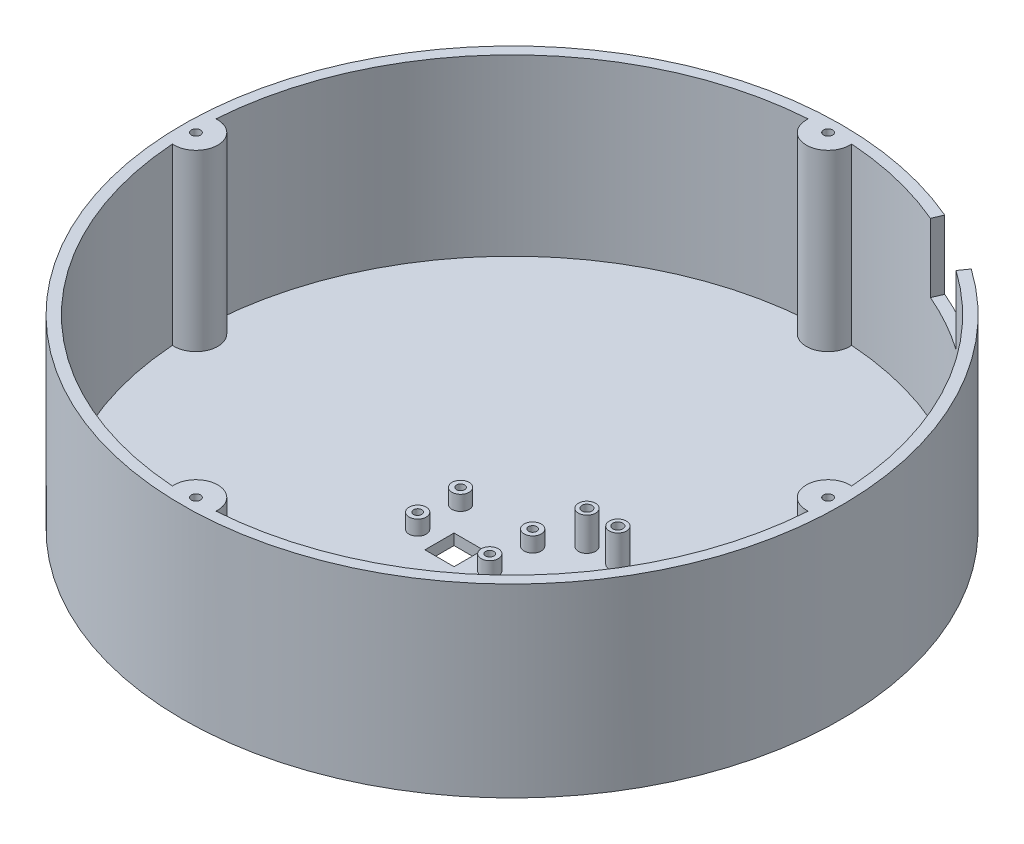
from build123d import *

# Parameters (mm, degrees)
SKETCH1_R                                            = 96
BOSS_EXTRUDE1_DEPTH                                  = 53.975
SKETCH2_R                                            = 1.3208
CUT_EXTRUDE1_DEPTH                                   = 50.8
SKETCH3_R                                            = 6
SKETCH3_W                                            = 8.5
SKETCH3_H                                            = 8.5
CUT_EXTRUDE2_DEPTH                                   = 145.957373045
BOSS_EXTRUDE2_START                                  = 3.175
BOSS_EXTRUDE2_OUTLINE_R                              = 2.5
BOSS_EXTRUDE2_DEPTH                                  = 4.325
BOSS_EXTRUDE3_START                                  = 3.175
BOSS_EXTRUDE3_OUTLINE_R                              = 2.5
BOSS_EXTRUDE3_DEPTH                                  = 9.652
CSK_FOR_M2_5_CROSS_COUNTERSUNK_HEAD_SCRE_D           = 2.9
CSK_FOR_M2_5_CROSS_COUNTERSUNK_HEAD_SCRE_CSINK_D     = 5
CSK_FOR_M2_5_CROSS_COUNTERSUNK_HEAD_SCRE_CSINK_ANGLE = 92
CSK_FOR_M2_CROSS_COUNTERSUNK_HEAD_SCREW1_D           = 2.4
CSK_FOR_M2_CROSS_COUNTERSUNK_HEAD_SCREW1_CSINK_D     = 4
CSK_FOR_M2_CROSS_COUNTERSUNK_HEAD_SCREW1_CSINK_ANGLE = 92
CUT_EXTRUDE4_DEPTH                                   = 20


# Read off the part's stored shape, not the designer's step: Boss-Extrude2, Boss-Extrude3
with BuildPart() as part:
    # Sketch1 → Boss-Extrude1 (new body)
    with BuildSketch(Plane(origin=(0, 0, 0), x_dir=(1, 0, 0), z_dir=(0, 1, 0))):
        with Locations(Location((0, 0, 0), (0, 0, 270))):
            Circle(SKETCH1_R)
    extrude(amount=BOSS_EXTRUDE1_DEPTH)

    # Sketch2 → Cut-Extrude1 (cut)
    with BuildSketch(Plane(origin=(0, 53.975, 0), x_dir=(1, 0, 0), z_dir=(0, 1, 0))):
        with Locations(Location((0, 92.075, 0), (0, 0, 270))):
            Circle(SKETCH2_R)
        with Locations(Location((92.075, 0, 0), (0, 0, 270))):
            Circle(SKETCH2_R)
        with Locations(Location((0, -92.075, 0), (0, 0, 270))):
            Circle(SKETCH2_R)
        with Locations(Location((-92.075, 0, 0), (0, 0, 270))):
            Circle(SKETCH2_R)
        with BuildLine():
            Line((92.609089058, 6.327499417), (92.607548963, 6.35))
            ThreePointArc((92.607548963, 6.35), (65.629212709, 65.64516025), (6.327499417, 92.609089058))
            ThreePointArc((6.327499417, 92.609089058), (0, 85.725), (-6.327499417, 92.609089058))
            ThreePointArc((-6.327499417, 92.609089058), (-65.637186964, 65.637186964), (-92.609089058, 6.327499417))
            ThreePointArc((-92.609089058, 6.327499417), (-85.725, 0), (-92.609089058, -6.327499417))
            Line((-92.609089058, -6.327499417), (-92.607548963, -6.35))
            ThreePointArc((-92.607548963, -6.35), (-65.629212709, -65.64516025), (-6.327499417, -92.609089058))
            ThreePointArc((-6.327499417, -92.609089058), (0, -85.725), (6.327499417, -92.609089058))
            Line((6.327499417, -92.609089058), (6.35, -92.607548963))
            ThreePointArc((6.35, -92.607548963), (65.64516025, -65.629212709), (92.609089058, -6.327499417))
            ThreePointArc((92.609089058, -6.327499417), (85.725, 0), (92.609089058, 6.327499417))
        make_face()
    extrude(amount=-CUT_EXTRUDE1_DEPTH, mode=Mode.SUBTRACT)

    # Sketch3 → Cut-Extrude2 (cut, through all)
    with BuildSketch(Plane(origin=(0, 3.175, 0), x_dir=(1, 0, 0), z_dir=(0, 1, 0))):
        with Locations(Location((23, -16.5546, 0), (0, 0, 270))):
            Circle(SKETCH3_R)
        with Locations((0, -16.8926)):
            Rectangle(SKETCH3_W, SKETCH3_H)
    extrude(amount=-CUT_EXTRUDE2_DEPTH, mode=Mode.SUBTRACT)

    # Boss-Extrude2 outline → Boss-Extrude2 (add)
    with BuildSketch(Plane(origin=(0, 0, 0), x_dir=(1, 0, 0), z_dir=(0, 1, 0)).offset(BOSS_EXTRUDE2_START)):
        with Locations((10.5, -4.4926)):
            Circle(BOSS_EXTRUDE2_OUTLINE_R)
        with Locations((10.5, -16.9926)):
            Circle(BOSS_EXTRUDE2_OUTLINE_R)
        with Locations((-10.5, -16.9926)):
            Circle(BOSS_EXTRUDE2_OUTLINE_R)
        with Locations((-10.5, -4.4926)):
            Circle(BOSS_EXTRUDE2_OUTLINE_R)
    extrude(amount=BOSS_EXTRUDE2_DEPTH)

    # Boss-Extrude3 outline → Boss-Extrude3 (add)
    with BuildSketch(Plane(origin=(0, 0, 0), x_dir=(1, 0, 0), z_dir=(0, 1, 0)).offset(BOSS_EXTRUDE3_START)):
        with Locations((27.5, 3.3254)):
            Circle(BOSS_EXTRUDE3_OUTLINE_R)
        with Locations((18.5, -45.6746)):
            Circle(BOSS_EXTRUDE3_OUTLINE_R)
        with Locations((27.5, -45.6746)):
            Circle(BOSS_EXTRUDE3_OUTLINE_R)
        with Locations((18.5, 3.3254)):
            Circle(BOSS_EXTRUDE3_OUTLINE_R)
    extrude(amount=BOSS_EXTRUDE3_DEPTH)

    # CSK for M2.5 Cross Countersunk Head Screw1 (through all)
    with Locations(Plane(origin=(0, 0, 0), x_dir=(-1, 0, 0), z_dir=(0, -1, 0))):
        with Locations((-27.5, 3.3254), (-18.5, 3.3254), (-27.5, -45.6746), (-18.5, -45.6746)):
            CounterSinkHole(CSK_FOR_M2_5_CROSS_COUNTERSUNK_HEAD_SCRE_D / 2, CSK_FOR_M2_5_CROSS_COUNTERSUNK_HEAD_SCRE_CSINK_D / 2, counter_sink_angle=CSK_FOR_M2_5_CROSS_COUNTERSUNK_HEAD_SCRE_CSINK_ANGLE)

    # CSK for M2 Cross Countersunk Head Screw1 (through all)
    with Locations(Plane(origin=(0, 0, 0), x_dir=(-1, 0, 0), z_dir=(0, -1, 0))):
        with Locations((10.5, -4.4926), (-10.5, -4.4926), (-10.5, -16.9926), (10.5, -16.9926)):
            CounterSinkHole(CSK_FOR_M2_CROSS_COUNTERSUNK_HEAD_SCREW1_D / 2, CSK_FOR_M2_CROSS_COUNTERSUNK_HEAD_SCREW1_CSINK_D / 2, counter_sink_angle=CSK_FOR_M2_CROSS_COUNTERSUNK_HEAD_SCREW1_CSINK_ANGLE)

    # Sketch10 → Cut-Extrude4 (cut)
    with BuildSketch(Plane(origin=(0, 53.975, 0), x_dir=(1, 0, 0), z_dir=(0, 1, 0))):
        with BuildLine():
            Line((37.80459918, 88.242916321), (36.554290822, 85.324465703))
            ThreePointArc((36.554290822, 85.324465703), (45.243395364, 81.052549626), (53.440238661, 75.898758335))
            Line((53.440238661, 75.898758335), (55.268116471, 78.494810667))
            ThreePointArc((55.268116471, 78.494810667), (46.790907136, 83.824882996), (37.80459918, 88.242916321))
        make_face()
    extrude(amount=-CUT_EXTRUDE4_DEPTH, mode=Mode.SUBTRACT)


solid = part.part
